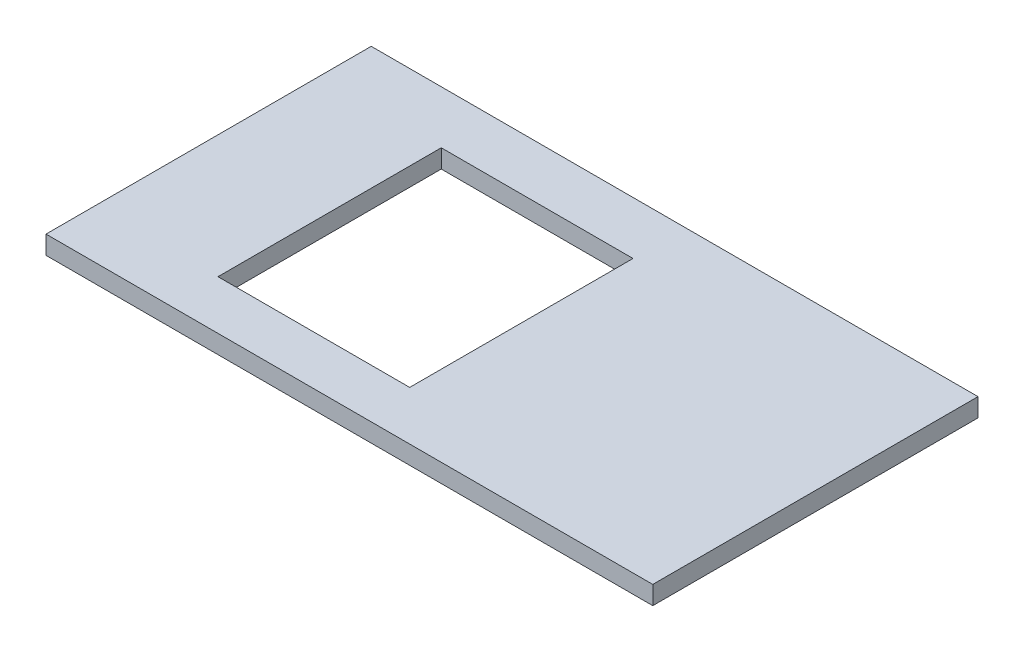
from build123d import *

# Parameters (mm, degrees)
SKETCH_1_W          = 1250
SKETCH_1_H          = 670
EXTRUDE_1_DEPTH     = 38
SKETCH_2_W          = 395
SKETCH_2_H          = 460
CUT_EXTRUDE_1_DEPTH = 1419.747334799


with BuildPart() as part:
    # Эскиз1 → Бобышка-Вытянуть1 (new body)
    with BuildSketch(Plane(origin=(0, 0, 0), x_dir=(1, 0, 0), z_dir=(0, 1, 0))):
        with Locations((625, 335)):
            Rectangle(SKETCH_1_W, SKETCH_1_H)
    extrude(amount=EXTRUDE_1_DEPTH)

    # Эскиз2 → Вырез-Вытянуть1 (cut, through all)
    with BuildSketch(Plane(origin=(0, 38, 0), x_dir=(1, 0, 0), z_dir=(0, 1, 0))):
        with Locations((450.655339667, 331.116391331)):
            Rectangle(SKETCH_2_W, SKETCH_2_H)
    extrude(amount=-CUT_EXTRUDE_1_DEPTH, mode=Mode.SUBTRACT)


solid = part.part
